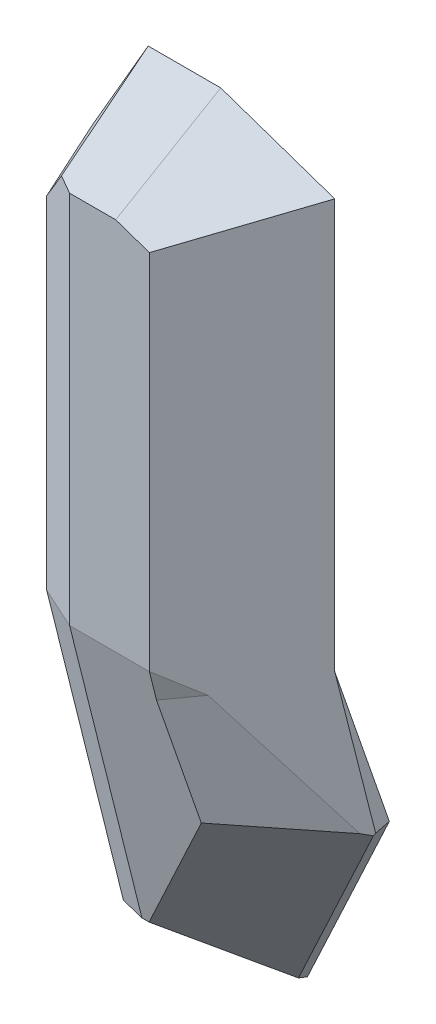
from build123d import *
from OCP.BRepFilletAPI import BRepFilletAPI_MakeChamfer

# Parameters (mm, degrees)
BOSS_EXTRUDE1_DEPTH = 10
BOSS_EXTRUDE2_DEPTH = 28.421968
CUT_EXTRUDE1_START  = -9.701425
CUT_EXTRUDE1_DEPTH  = 9.701425
CHAMFER2_SIZE       = 8
CHAMFER2_SIZE_2     = 10
CHAMFER3_START      = 25.809398
CHAMFER3_OUTLINE_W  = 20
CHAMFER3_OUTLINE_H  = 63
CHAMFER3_DEPTH      = 8.190602
CHAMFER4_SIZE       = 10
CHAMFER4_SIZE_2     = 4
CHAMFER5_SIZE       = 3.590067
CHAMFER5_SIZE_2     = 2


with BuildPart() as part:
    # Sketch1 → Boss-Extrude1 (new body)
    with BuildSketch(Plane.XY):
        Polygon((24.191671, 28.419998), (16.362555, 28.419998), (10.289541, 17.951075), (10.289541, -20), (36.5, -20), (36.5, 24.2), align=None)
    extrude(amount=BOSS_EXTRUDE1_DEPTH)

    # Sketch2 → Boss-Extrude2 (add)
    with BuildSketch(Plane.ZY.offset(-10.289541)):
        Polygon((0, -20), (-10, -60), (2.186465, -51.25414), (10, -20), align=None)
    extrude(amount=-BOSS_EXTRUDE2_DEPTH)

    # Cut-Extrude1: read off the stored shape, not the designer's step
    # Cut-Extrude1 outline → Cut-Extrude1 (cut)
    with BuildSketch(Plane(origin=(0, -1.176471, 4.705882), x_dir=(-1, 0, 0), z_dir=(0, 0.24253562503633297, -0.9701425001453319)).offset(CUT_EXTRUDE1_START)):
        Polygon((-38.711509, -34.599995), (-36.5, -19.40285), (-36.5, -11.244925), (-38.711509, -11.244925), align=None)
        Polygon((-23.557547, -60.633906), (-38.711509, -34.599995), (-38.711509, -60.633906), align=None)
    extrude(amount=CUT_EXTRUDE1_DEPTH, mode=Mode.SUBTRACT)

    # Chamfer2
    chamfer2_edges_1 = [part.edges().sort_by_distance(p)[0] for p in [
        (34.464169, -44.175239, 3.95619),
    ]]
    chamfer2_side_1 = [part.faces().sort_by_distance(p)[0] for p in [
        (34.464169, -44.136433, 3.800967),
    ]]
    chamfer2_edges_2 = [part.edges().sort_by_distance(p)[0] for p in [
        (37.605755, -29.724638, 7.56884),
    ]]
    chamfer2_side_2 = [part.faces().sort_by_distance(p)[0] for p in [
        (37.605755, -29.685832, 7.413618),
    ]]
    chamfer2_edges_3 = [part.edges().sort_by_distance(p)[0] for p in [
        (36.5, -21.176471, 9.705882),
    ]]
    chamfer2_side_3 = [part.faces().sort_by_distance(p)[0] for p in [
        (36.5, -21.137665, 9.55066),
    ]]
    chamfer2_edges_4 = [part.edges().sort_by_distance(p)[0] for p in [
        (30.345836, 26.309999, 10),
    ]]
    chamfer2_side_4 = [part.faces().sort_by_distance(p)[0] for p in [
        (30.293944, 26.158648, 10),
    ]]
    chamfer2_edges_5 = [part.edges().sort_by_distance(p)[0] for p in [
        (20.277113, 28.419998, 10),
    ]]
    chamfer2_side_5 = [part.faces().sort_by_distance(p)[0] for p in [
        (20.277113, 28.419998, 9.84),
    ]]
    chamfer2 = BRepFilletAPI_MakeChamfer(part.part.solid().wrapped)
    for e in chamfer2_edges_1:
        chamfer2.Add(CHAMFER2_SIZE - 0.0001, CHAMFER2_SIZE_2 - 0.0001, e.wrapped, chamfer2_side_1[0].wrapped)
    for e in chamfer2_edges_2:
        chamfer2.Add(CHAMFER2_SIZE - 0.0001, CHAMFER2_SIZE_2 - 0.0001, e.wrapped, chamfer2_side_2[0].wrapped)
    for e in chamfer2_edges_3:
        chamfer2.Add(CHAMFER2_SIZE - 0.0001, CHAMFER2_SIZE_2 - 0.0001, e.wrapped, chamfer2_side_3[0].wrapped)
    for e in chamfer2_edges_4:
        chamfer2.Add(CHAMFER2_SIZE - 0.0001, CHAMFER2_SIZE_2 - 0.0001, e.wrapped, chamfer2_side_4[0].wrapped)
    for e in chamfer2_edges_5:
        chamfer2.Add(CHAMFER2_SIZE_2 - 0.0001, CHAMFER2_SIZE - 0.0001, e.wrapped, chamfer2_side_5[0].wrapped)
    add(Compound.cast(chamfer2.Shape()), mode=Mode.REPLACE)  # a hair under: the kernel refuses the full size

    # Chamfer3: read off the stored shape, not the designer's step
    # Chamfer3 outline → Chamfer3 (cut)
    with BuildSketch(Plane(origin=(0, 0, 0), x_dir=(0.7071067811865465, 0, -0.7071067811865487), z_dir=(0.7071067811865486, 0, 0.7071067811865466)).offset(CHAMFER3_START)):
        with Locations((20, -5.5)):
            Rectangle(CHAMFER3_OUTLINE_W, CHAMFER3_OUTLINE_H)
    extrude(amount=CHAMFER3_DEPTH, mode=Mode.SUBTRACT)

    # Chamfer4
    chamfer4_edges_1 = [part.edges().sort_by_distance(p)[0] for p in [
        (10.289541, -35.62707, 6.093233),
    ]]
    chamfer4_side_1 = [part.faces().sort_by_distance(p)[0] for p in [
        (10.289541, -35.607667, 6.015621),
    ]]
    chamfer4_edges_2 = [part.edges().sort_by_distance(p)[0] for p in [
        (10.289541, -1.024463, 10),
    ]]
    chamfer4_side_2 = [part.faces().sort_by_distance(p)[0] for p in [
        (10.369541, -1.024463, 10),
    ]]
    chamfer4_edges_3 = [part.edges().sort_by_distance(p)[0] for p in [
        (11.00568, 19.185587, 10),
    ]]
    chamfer4_side_3 = [part.faces().sort_by_distance(p)[0] for p in [
        (11.00568, 19.185587, 9.92),
    ]]
    chamfer4 = BRepFilletAPI_MakeChamfer(part.part.solid().wrapped)
    for e in chamfer4_edges_1:
        chamfer4.Add(CHAMFER4_SIZE - 0.0001, CHAMFER4_SIZE_2 - 0.0001, e.wrapped, chamfer4_side_1[0].wrapped)
    for e in chamfer4_edges_2:
        chamfer4.Add(CHAMFER4_SIZE_2 - 0.0001, CHAMFER4_SIZE - 0.0001, e.wrapped, chamfer4_side_2[0].wrapped)
    for e in chamfer4_edges_3:
        chamfer4.Add(CHAMFER4_SIZE - 0.0001, CHAMFER4_SIZE_2 - 0.0001, e.wrapped, chamfer4_side_3[0].wrapped)
    add(Compound.cast(chamfer4.Shape()), mode=Mode.REPLACE)  # a hair under: the kernel refuses the full size

    # Chamfer5
    # the kernel refuses this chamfer: 3.590067, 2 mm, written as the material it takes off along each edge
    with BuildSketch(Plane(origin=(14.289441, -60.282499, -0.070625), x_dir=(1, 0, 0), z_dir=(0, 0.9701425001453319, 0.24253562503633294))) as chamfer5_piece_1:
        Polygon((CHAMFER5_SIZE, 0), (-CHAMFER5_SIZE_2 * 0.371385873826, CHAMFER5_SIZE_2 * 0.928478611882), (0, 0), align=None)
    extrude(amount=88.053346, mode=Mode.SUBTRACT)
    with BuildSketch(Plane(origin=(14.289441, 26.181109, 10), x_dir=(1, 0, 0), z_dir=(0, -1, 0))) as chamfer5_piece_2:
        Polygon((CHAMFER5_SIZE, 0), (-CHAMFER5_SIZE_2 * 0.371385873826, -CHAMFER5_SIZE_2 * 0.928478611882), (0, 0), align=None)
    extrude(amount=92.712206, mode=Mode.SUBTRACT)


solid = part.part
